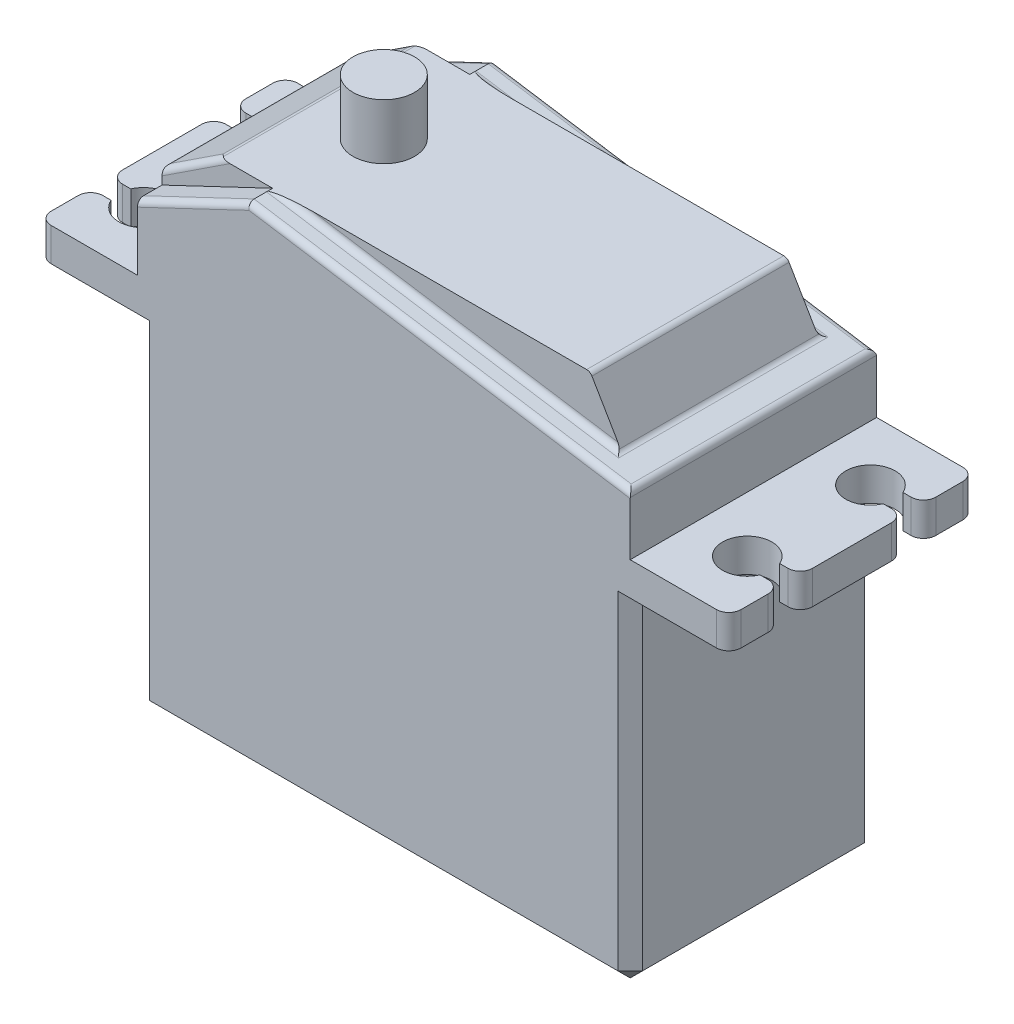
from build123d import *

# Parameters (mm, degrees)
EXTRUDE_1_DEPTH     = 27.7
EXTRUDE_2_DEPTH     = 2.7
SKETCH_3_W          = 40
SKETCH_3_H          = 20.000000000000004
EXTRUDE_3_DEPTH     = 9.600000000000001
SKETCH_4_R          = 2.5000000000000004
EXTRUDE_4_DEPTH     = 4.5
CHAMFER_1_SIZE      = 1
FILLET_1_R          = 1
CUT_EXTRUDE_1_DEPTH = 2
CUT_EXTRUDE_2_DEPTH = 2
CUT_EXTRUDE_3_DEPTH = 44.304618691312825
CUT_EXTRUDE_4_DEPTH = 44.304618691312825
FILLET_3_R          = 0.5


with BuildPart() as part:
    # 草图1 → 凸台-拉伸1 (new body)
    with BuildSketch(Plane(origin=(0, 0, 0), x_dir=(1, 0, 0), z_dir=(0, 1, 0))):
        Polygon((-19.999999999999996, 10), (20.000000000000004, 10), (20.00000000000001, -10), (-19.99999999999999, -10), align=None)
    extrude(amount=-EXTRUDE_1_DEPTH)

    # 草图2 → 凸台-拉伸2 (add)
    with BuildSketch(Plane(origin=(0, 0, 0), x_dir=(1, 0, 0), z_dir=(0, 1, 0))):
        with BuildLine():
            Line((-26.999999999999996, 9.999999999999998), (26.99999999999999, 9.999999999999998))
            ThreePointArc((26.99999999999999, 9.999999999999998), (27.707106781186543, 9.707106781186546), (27.999999999999996, 8.999999999999991))
            Line((27.999999999999996, 8.999999999999991), (27.999999999999996, 6.800000000000006))
            ThreePointArc((27.999999999999996, 6.800000000000006), (27.707106781186543, 6.092893218813451), (26.99999999999999, 5.799999999999999))
            Line((26.99999999999999, 5.799999999999999), (26.33303027798234, 5.799999999999999))
            ThreePointArc((26.33303027798234, 5.799999999999999), (22.499999999999996, 4.999999999999993), (26.333030277982342, 4.2))
            Line((26.333030277982342, 4.2), (26.999999999999993, 4.2))
            ThreePointArc((26.999999999999993, 4.2), (27.707106781186546, 3.907106781186547), (28, 3.1999999999999926))
            Line((28, 3.1999999999999926), (28, -3.199999999999997))
            ThreePointArc((28, -3.199999999999997), (27.70710678118655, -3.9071067811865494), (27, -4.200000000000005))
            Line((27, -4.200000000000005), (26.333030277982342, -4.200000000000008))
            ThreePointArc((26.333030277982342, -4.200000000000008), (22.499999999999996, -5.000000000000002), (26.333030277982342, -5.8000000000000025))
            Line((26.333030277982342, -5.8000000000000025), (26.999999999999996, -5.8000000000000025))
            ThreePointArc((26.999999999999996, -5.8000000000000025), (27.70710678118655, -6.092893218813455), (28.000000000000004, -6.80000000000001))
            Line((28.000000000000004, -6.80000000000001), (28.000000000000004, -8.999999999999995))
            ThreePointArc((28.000000000000004, -8.999999999999995), (27.70710678118655, -9.70710678118655), (26.999999999999996, -10.000000000000002))
            Line((26.999999999999996, -10.000000000000002), (-26.999999999999993, -10.000000000000002))
            ThreePointArc((-26.999999999999993, -10.000000000000002), (-27.70710678118655, -9.70710678118655), (-28, -8.999999999999995))
            Line((-28, -8.999999999999995), (-28, -6.800000000000009))
            ThreePointArc((-28, -6.800000000000009), (-27.707106781186546, -6.092893218813454), (-26.999999999999993, -5.800000000000002))
            Line((-26.999999999999993, -5.800000000000002), (-26.333030277982335, -5.800000000000002))
            ThreePointArc((-26.333030277982335, -5.800000000000002), (-22.5, -5), (-26.333030277982335, -4.199999999999999))
            Line((-26.333030277982335, -4.199999999999999), (-26.999999999999993, -4.199999999999999))
            ThreePointArc((-26.999999999999993, -4.199999999999999), (-27.707106781186546, -3.9071067811865468), (-28, -3.1999999999999926))
            Line((-28, -3.1999999999999926), (-28.000000000000004, 3.1999999999999917))
            ThreePointArc((-28.000000000000004, 3.1999999999999917), (-27.707106781186553, 3.9071067811865468), (-26.999999999999996, 4.2))
            Line((-26.999999999999996, 4.2), (-26.333030277982335, 4.2))
            ThreePointArc((-26.333030277982335, 4.2), (-22.5, 5), (-26.333030277982335, 5.800000000000001))
            Line((-26.333030277982335, 5.800000000000001), (-26.999999999999996, 5.800000000000001))
            ThreePointArc((-26.999999999999996, 5.800000000000001), (-27.70710678118655, 6.092893218813453), (-28.000000000000004, 6.800000000000008))
            Line((-28.000000000000004, 6.800000000000008), (-28.000000000000004, 8.999999999999991))
            ThreePointArc((-28.000000000000004, 8.999999999999991), (-27.70710678118655, 9.707106781186546), (-26.999999999999996, 9.999999999999998))
        make_face()
    extrude(amount=EXTRUDE_2_DEPTH)

    # 草图3 → 凸台-拉伸3 (add)
    with BuildSketch(Plane(origin=(0, 2.7, 0), x_dir=(1, 0, 0), z_dir=(0, 1, 0))):
        Rectangle(SKETCH_3_W, SKETCH_3_H)
    extrude(amount=EXTRUDE_3_DEPTH)

    # 草图4 → 凸台-拉伸4 (add)
    with BuildSketch(Plane(origin=(0, 12.300000000000002, 0), x_dir=(1, 0, 0), z_dir=(0, 1, 0))):
        with Locations(Location((-10.000000000000004, 0, 0), (0, 0, 270))):
            Circle(SKETCH_4_R)
    extrude(amount=EXTRUDE_4_DEPTH)

    # 倒角1
    chamfer_1_edges = [part.edges().sort_by_distance(p)[0] for p in [
        (-19.999999999999993, -27.7, 0),
        (1.066e-14, -27.7, 10),
        (20.000000000000007, -27.7, 0),
        (3.55e-15, -27.7, -10),
        (20.00000000000001, -13.85, 10),
        (-19.99999999999999, -13.85, 10),
        (-19.999999999999996, -13.85, -10),
        (20.000000000000004, -13.85, -10),
    ]]
    chamfer(chamfer_1_edges, length=CHAMFER_1_SIZE)

    # 圆角1
    fillet_1_edges = [part.edges().sort_by_distance(p)[0] for p in [
        (20.000000000000007, 0, 1.78e-15),
        (-19.999999999999993, 0, 1.78e-15),
    ]]
    fillet(fillet_1_edges, radius=FILLET_1_R)

    # 草图5 → 切除-拉伸1 (cut)
    with BuildSketch(Plane.XY.offset(10)):
        Polygon((-20.000000000000004, 12.300000000000002), (-20.000000000000004, 8.035927133186778), (-11.021709653774844, 12.300000000000002), align=None)
        Polygon((19.999999999999996, 12.300000000000002), (-11.021709653774844, 12.300000000000002), (19.999999999999996, 7.500000000000002), align=None)
    extrude(amount=-CUT_EXTRUDE_1_DEPTH, mode=Mode.SUBTRACT)

    # 草图6 → 切除-拉伸2 (cut)
    with BuildSketch(Plane(origin=(0, 0, -10), x_dir=(-1, 0, 0), z_dir=(0, 0, -1))):
        Polygon((-19.999999999999996, 12.300000000000002), (-19.999999999999996, 7.500000000000002), (11.021709653774877, 12.300000000000006), align=None)
        Polygon((20.000000000000004, 12.300000000000002), (11.021709653774877, 12.300000000000002), (20.000000000000004, 8.035927133186778), (20.000000000000004, 8.518007588496584), align=None)
    extrude(amount=-CUT_EXTRUDE_2_DEPTH, mode=Mode.SUBTRACT)

    # 草图7 → 切除-拉伸3 (cut, through all)
    with BuildSketch(Plane.XY.offset(8)):
        Polygon((14.749194246022505, 12.300000000000002), (17.321583388310543, 7.914432340435016), (19.999999999999996, 7.500000000000002), (19.999999999999996, 12.300000000000002), align=None)
    extrude(amount=-CUT_EXTRUDE_3_DEPTH, mode=Mode.SUBTRACT)

    # 草图8 → 切除-拉伸4 (cut, through all)
    with BuildSketch(Plane(origin=(0, 0, -8), x_dir=(-1, 0, 0), z_dir=(0, 0, -1))):
        Polygon((15.395101165410264, 12.3), (20.000000000000004, 9.27677625524631), (20.000000000000004, 12.300000000000002), align=None)
    extrude(amount=-CUT_EXTRUDE_4_DEPTH, mode=Mode.SUBTRACT)

    # 圆角3
    # the kernel refuses this fillet: 0.5 mm, written as the material it adds along each edge
    with BuildSketch(Plane(origin=(18.55688339677409, 7.723293937464904, -8), x_dir=(6e-17, 4.1e-16, -1), z_dir=(-0.9882400067708363, 0.15291072237608927, 0))) as fillet_3_piece_1_section:
        with BuildLine():
            CenterArc((FILLET_3_R, -FILLET_3_R), FILLET_3_R, 90.00000000000003, 90.00000000000011)
            Line((2.1e-16, -FILLET_3_R), (-FILLET_3_R * 0.02, -FILLET_3_R))
            Line((-FILLET_3_R * 0.02, -FILLET_3_R), (-FILLET_3_R * 0.02, FILLET_3_R * 0.02))
            Line((-FILLET_3_R * 0.02, FILLET_3_R * 0.02), (FILLET_3_R, FILLET_3_R * 0.02))
            Line((FILLET_3_R, FILLET_3_R * 0.02), (FILLET_3_R, 0))
        make_face()
    fillet_3_piece_1 = extrude(amount=31.180576426671607, mode=Mode.PRIVATE)
    fillet_3_piece_1 = split(fillet_3_piece_1, bisect_by=Plane(origin=(-0.01892956266556034, 17.525566810248893, -8.114981645981509), z_dir=(0.4290063256586747, -0.9033014848569901, 0)), keep=Keep.TOP, mode=Mode.PRIVATE)
    fillet_3_piece_1 = split(fillet_3_piece_1, bisect_by=Plane(origin=(3.4752380562903062, 12.3, -8.114981645981509), z_dir=(0, -1, 0)), keep=Keep.TOP, mode=Mode.PRIVATE)
    fillet_3_piece_1 = split(fillet_3_piece_1, bisect_by=Plane(origin=(12.79355457582578, 15.634095122073386, -8.114981645981509), z_dir=(-0.8625658684116786, -0.5059447822156158, 0)), keep=Keep.TOP, mode=Mode.PRIVATE)
    add(fillet_3_piece_1)
    with BuildSketch(Plane(origin=(-12.257009662238392, 12.491138402970114, 8), x_dir=(5.4e-16, 3.47e-15, 1), z_dir=(0.9882400067708363, -0.15291072237608935, 0))) as fillet_3_piece_2_section:
        with BuildLine():
            CenterArc((FILLET_3_R, -FILLET_3_R), FILLET_3_R, 90.0000000000002, 89.9999999999998)
            Line((1.76e-15, -FILLET_3_R), (-FILLET_3_R * 0.02, -FILLET_3_R))
            Line((-FILLET_3_R * 0.02, -FILLET_3_R), (-FILLET_3_R * 0.02, FILLET_3_R * 0.02))
            Line((-FILLET_3_R * 0.02, FILLET_3_R * 0.02), (FILLET_3_R, FILLET_3_R * 0.02))
            Line((FILLET_3_R, FILLET_3_R * 0.02), (FILLET_3_R, 0))
        make_face()
    fillet_3_piece_2 = extrude(amount=31.18057642667156, mode=Mode.PRIVATE)
    fillet_3_piece_2 = split(fillet_3_piece_2, bisect_by=Plane(origin=(-0.0189295626653454, 17.525566810248954, 8.114981645981516), z_dir=(0.4290063256586731, -0.9033014848569909, 0)), keep=Keep.TOP, mode=Mode.PRIVATE)
    fillet_3_piece_2 = split(fillet_3_piece_2, bisect_by=Plane(origin=(3.4752380562905487, 12.3, 8.114981645981516), z_dir=(0, -1, 0)), keep=Keep.TOP, mode=Mode.PRIVATE)
    fillet_3_piece_2 = split(fillet_3_piece_2, bisect_by=Plane(origin=(12.793554575825858, 15.634095122073255, 8.114981645981516), z_dir=(-0.8625658684116786, -0.5059447822156158, 0)), keep=Keep.TOP, mode=Mode.PRIVATE)
    add(fillet_3_piece_2)
    with BuildSketch(Plane(origin=(17.321583388310543, 7.914432340435016, 8), x_dir=(0.9882400067708361, -0.15291072237609032, 0), z_dir=(0, 0, -1))) as fillet_3_piece_3:
        with BuildLine():
            CenterArc((FILLET_3_R * 0.47494469979, -FILLET_3_R), FILLET_3_R, 90.00000000000009, 50.81026573498599)
            Line((-FILLET_3_R * 0.300113017719, -FILLET_3_R * 0.368109554962), (-FILLET_3_R * 0.315614172069, -FILLET_3_R * 0.355471746061))
            Line((-FILLET_3_R * 0.315614172069, -FILLET_3_R * 0.355471746061), (-FILLET_3_R * 0.0094988939958, FILLET_3_R * 0.02))
            Line((-FILLET_3_R * 0.0094988939958, FILLET_3_R * 0.02), (FILLET_3_R * 0.47494469979, FILLET_3_R * 0.02))
            Line((FILLET_3_R * 0.47494469979, FILLET_3_R * 0.02), (FILLET_3_R * 0.47494469979, 0))
        make_face()
    extrude(amount=15.999999999999998)
    with BuildSketch(Plane(origin=(17.321583388310543, 7.914432340435016, 8), x_dir=(0.9882400067708361, -0.15291072237609032, 0), z_dir=(0, 0, -1))) as fillet_3_piece_4a_section:
        with BuildLine():
            CenterArc((FILLET_3_R * 0.47494469979, -FILLET_3_R), FILLET_3_R, 90.00000000000009, 50.81026573498599)
            Line((-FILLET_3_R * 0.300113017719, -FILLET_3_R * 0.368109554962), (-FILLET_3_R * 0.315614172069, -FILLET_3_R * 0.355471746061))
            Line((-FILLET_3_R * 0.315614172069, -FILLET_3_R * 0.355471746061), (-FILLET_3_R * 0.0094988939958, FILLET_3_R * 0.02))
            Line((-FILLET_3_R * 0.0094988939958, FILLET_3_R * 0.02), (FILLET_3_R * 0.47494469979, FILLET_3_R * 0.02))
            Line((FILLET_3_R * 0.47494469979, FILLET_3_R * 0.02), (FILLET_3_R * 0.47494469979, 0))
        make_face()
    fillet_3_piece_4a = extrude(amount=16.593680874737203, mode=Mode.PRIVATE)
    fillet_3_piece_4a = split(fillet_3_piece_4a, bisect_by=Plane(origin=(17.346078817666946, 7.95047521751959, -8), z_dir=(0, 0, -1)), keep=Keep.TOP, mode=Mode.PRIVATE)
    with BuildSketch(Plane(origin=(18.55688339677409, 7.723293937464904, -8), x_dir=(6e-17, 4.1e-16, -1), z_dir=(-0.9882400067708363, 0.15291072237608927, 0))) as fillet_3_piece_4b_section:
        with BuildLine():
            CenterArc((FILLET_3_R, -FILLET_3_R), FILLET_3_R, 90.00000000000003, 90.00000000000011)
            Line((2.1e-16, -FILLET_3_R), (-FILLET_3_R * 0.02, -FILLET_3_R))
            Line((-FILLET_3_R * 0.02, -FILLET_3_R), (-FILLET_3_R * 0.02, FILLET_3_R * 0.02))
            Line((-FILLET_3_R * 0.02, FILLET_3_R * 0.02), (FILLET_3_R, FILLET_3_R * 0.02))
            Line((FILLET_3_R, FILLET_3_R * 0.02), (FILLET_3_R, 0))
        make_face()
    fillet_3_piece_4b = extrude(amount=31.180576426671607, mode=Mode.PRIVATE)
    fillet_3_piece_4b = split(fillet_3_piece_4b, bisect_by=Plane(origin=(17.458568610998494, 7.680891484355894, -8.109028377758598), z_dir=(0.8625658684116786, 0.5059447822156158, 0)), keep=Keep.TOP, mode=Mode.PRIVATE)
    fillet_3_piece_4 = fillet_3_piece_4a & fillet_3_piece_4b
    add(fillet_3_piece_4)
    with BuildSketch(Plane(origin=(-12.257009662238392, 12.491138402970114, 8), x_dir=(5.4e-16, 3.47e-15, 1), z_dir=(0.9882400067708363, -0.15291072237608935, 0))) as fillet_3_piece_5a_section:
        with BuildLine():
            CenterArc((FILLET_3_R, -FILLET_3_R), FILLET_3_R, 90.0000000000002, 89.9999999999998)
            Line((1.76e-15, -FILLET_3_R), (-FILLET_3_R * 0.02, -FILLET_3_R))
            Line((-FILLET_3_R * 0.02, -FILLET_3_R), (-FILLET_3_R * 0.02, FILLET_3_R * 0.02))
            Line((-FILLET_3_R * 0.02, FILLET_3_R * 0.02), (FILLET_3_R, FILLET_3_R * 0.02))
            Line((FILLET_3_R, FILLET_3_R * 0.02), (FILLET_3_R, 0))
        make_face()
    fillet_3_piece_5a = extrude(amount=31.18057642667156, mode=Mode.PRIVATE)
    fillet_3_piece_5a = split(fillet_3_piece_5a, bisect_by=Plane(origin=(17.458568610998455, 7.68089148435596, 8.109028377758605), z_dir=(0.8625658684116786, 0.5059447822156158, 0)), keep=Keep.TOP, mode=Mode.PRIVATE)
    with BuildSketch(Plane(origin=(17.321583388310543, 7.914432340435015, 8.593680874737206), x_dir=(0.9882400067708367, -0.15291072237608666, 0), z_dir=(0, 0, -1))) as fillet_3_piece_5b_section:
        with BuildLine():
            CenterArc((FILLET_3_R * 0.47494469979, -FILLET_3_R), FILLET_3_R, 90.0000000000003, 50.810265734986004)
            Line((-FILLET_3_R * 0.300113017719, -FILLET_3_R * 0.368109554962), (-FILLET_3_R * 0.315614172069, -FILLET_3_R * 0.355471746061))
            Line((-FILLET_3_R * 0.315614172069, -FILLET_3_R * 0.355471746061), (-FILLET_3_R * 0.0094988939958, FILLET_3_R * 0.02))
            Line((-FILLET_3_R * 0.0094988939958, FILLET_3_R * 0.02), (FILLET_3_R * 0.47494469979, FILLET_3_R * 0.02))
            Line((FILLET_3_R * 0.47494469979, FILLET_3_R * 0.02), (FILLET_3_R * 0.47494469979, 0))
        make_face()
    fillet_3_piece_5b = extrude(amount=16.593680874737203, mode=Mode.PRIVATE)
    fillet_3_piece_5b = split(fillet_3_piece_5b, bisect_by=Plane(origin=(17.346078817666942, 7.950475217519592, 8), z_dir=(0, 0, 1)), keep=Keep.TOP, mode=Mode.PRIVATE)
    fillet_3_piece_5 = fillet_3_piece_5a & fillet_3_piece_5b
    add(fillet_3_piece_5)
    # the kernel refuses this fillet: 0.5 mm, written as the material it takes off along each edge
    with BuildSketch(Plane(origin=(-21.12912685607124, 7.499669226113436, 10.000000000000002), x_dir=(-6.2e-16, 1.3e-15, -1), z_dir=(0.9033014848569909, 0.4290063256586731, 0))) as fillet_3_2_piece_1_section:
        with BuildLine():
            CenterArc((FILLET_3_R, -FILLET_3_R), FILLET_3_R, 89.99999999999993, 90.00000000000017)
            Line((-7.2e-16, -FILLET_3_R), (-FILLET_3_R * 0.02, -FILLET_3_R))
            Line((-FILLET_3_R * 0.02, -FILLET_3_R), (-FILLET_3_R * 0.02, FILLET_3_R * 0.02))
            Line((-FILLET_3_R * 0.02, FILLET_3_R * 0.02), (FILLET_3_R, FILLET_3_R * 0.02))
            Line((FILLET_3_R, FILLET_3_R * 0.02), (FILLET_3_R, 0))
        make_face()
    fillet_3_2_piece_1 = extrude(amount=12.439417234154758, mode=Mode.PRIVATE)
    fillet_3_2_piece_1 = split(fillet_3_2_piece_1, bisect_by=Plane(origin=(-14.972592275789518, 12.911321451890478, 9.888117464776716), z_dir=(-0.15291072237608935, -0.9882400067708363, 0)), keep=Keep.TOP, mode=Mode.PRIVATE)
    fillet_3_2_piece_1 = split(fillet_3_2_piece_1, bisect_by=Plane(origin=(-20.000000000000004, 10.088373749739164, 9.888117464776716), z_dir=(1, 0, 0)), keep=Keep.TOP, mode=Mode.PRIVATE)
    add(fillet_3_2_piece_1, mode=Mode.SUBTRACT)
    with BuildSketch(Plane(origin=(-12.257009662238392, 12.491138402970114, 10.000000000000002), x_dir=(5.4e-16, 3.47e-15, -1), z_dir=(0.9882400067708363, -0.15291072237608935, 0))) as fillet_3_2_piece_2_section:
        with BuildLine():
            CenterArc((FILLET_3_R, -FILLET_3_R), FILLET_3_R, 89.9999999999998, 90.00000000000023)
            Line((-1.76e-15, -FILLET_3_R), (-FILLET_3_R * 0.02, -FILLET_3_R))
            Line((-FILLET_3_R * 0.02, -FILLET_3_R), (-FILLET_3_R * 0.02, FILLET_3_R * 0.02))
            Line((-FILLET_3_R * 0.02, FILLET_3_R * 0.02), (FILLET_3_R, FILLET_3_R * 0.02))
            Line((FILLET_3_R, FILLET_3_R * 0.02), (FILLET_3_R, 0))
        make_face()
    fillet_3_2_piece_2 = extrude(amount=33.8908660256946, mode=Mode.PRIVATE)
    fillet_3_2_piece_2 = split(fillet_3_2_piece_2, bisect_by=Plane(origin=(19.999999999999996, 9.79899811194415, 9.88715596257419), z_dir=(-1, 0, 0)), keep=Keep.TOP, mode=Mode.PRIVATE)
    fillet_3_2_piece_2 = split(fillet_3_2_piece_2, bisect_by=Plane(origin=(0.5906251511246445, 17.815063542441713, 9.887155962574187), z_dir=(0.4290063256586731, -0.9033014848569909, 0)), keep=Keep.TOP, mode=Mode.PRIVATE)
    add(fillet_3_2_piece_2, mode=Mode.SUBTRACT)
    with BuildSketch(Plane(origin=(19.999999999999996, 7.500000000000002, 10), x_dir=(0, -1, 0), z_dir=(0, 0, -1))) as fillet_3_2_piece_3:
        with BuildLine():
            CenterArc((FILLET_3_R * 0.857169586153, FILLET_3_R), FILLET_3_R, 188.79564505060517, 81.20435494939483)
            Line((-FILLET_3_R * 0.131070420618, FILLET_3_R * 0.847089277624), (-FILLET_3_R * 0.150835220753, FILLET_3_R * 0.844031063176))
            Line((-FILLET_3_R * 0.150835220753, FILLET_3_R * 0.844031063176), (-FILLET_3_R * 0.0171433917231, -FILLET_3_R * 0.02))
            Line((-FILLET_3_R * 0.0171433917231, -FILLET_3_R * 0.02), (FILLET_3_R * 0.857169586153, -FILLET_3_R * 0.02))
            Line((FILLET_3_R * 0.857169586153, -FILLET_3_R * 0.02), (FILLET_3_R * 0.857169586153, 0))
        make_face()
    extrude(amount=20, mode=Mode.SUBTRACT)
    with BuildSketch(Plane(origin=(-12.257009662238424, 12.491138402970119, -9.999999999999996), x_dir=(0, 0, 1), z_dir=(0.9882400067708363, -0.15291072237608921, 0))) as fillet_3_2_piece_4_section:
        with BuildLine():
            CenterArc((FILLET_3_R, FILLET_3_R), FILLET_3_R, 180, 90)
            Line((0, FILLET_3_R), (-FILLET_3_R * 0.02, FILLET_3_R))
            Line((-FILLET_3_R * 0.02, FILLET_3_R), (-FILLET_3_R * 0.02, -FILLET_3_R * 0.02))
            Line((-FILLET_3_R * 0.02, -FILLET_3_R * 0.02), (FILLET_3_R, -FILLET_3_R * 0.02))
            Line((FILLET_3_R, -FILLET_3_R * 0.02), (FILLET_3_R, 0))
        make_face()
    fillet_3_2_piece_4 = extrude(amount=33.890866025694635, mode=Mode.PRIVATE)
    fillet_3_2_piece_4 = split(fillet_3_2_piece_4, bisect_by=Plane(origin=(19.999999999999996, 9.798998111939396, -9.887155962573853), z_dir=(-1, 0, 0)), keep=Keep.TOP, mode=Mode.PRIVATE)
    fillet_3_2_piece_4 = split(fillet_3_2_piece_4, bisect_by=Plane(origin=(0.5906251511489238, 17.815063542453288, -9.887155962573853), z_dir=(0.4290063256586747, -0.9033014848569901, 0)), keep=Keep.TOP, mode=Mode.PRIVATE)
    add(fillet_3_2_piece_4, mode=Mode.SUBTRACT)
    with BuildSketch(Plane(origin=(-9.89258279770364, 12.83625790707335, -9.999999999999998), x_dir=(0, 0, 1), z_dir=(-0.9033014848569901, -0.4290063256586747, 0))) as fillet_3_2_piece_5_section:
        with BuildLine():
            CenterArc((FILLET_3_R, -FILLET_3_R), FILLET_3_R, 90, 90)
            Line((0, -FILLET_3_R), (-FILLET_3_R * 0.02, -FILLET_3_R))
            Line((-FILLET_3_R * 0.02, -FILLET_3_R), (-FILLET_3_R * 0.02, FILLET_3_R * 0.02))
            Line((-FILLET_3_R * 0.02, FILLET_3_R * 0.02), (FILLET_3_R, FILLET_3_R * 0.02))
            Line((FILLET_3_R, FILLET_3_R * 0.02), (FILLET_3_R, 0))
        make_face()
    fillet_3_2_piece_5 = extrude(amount=12.439417234154732, mode=Mode.PRIVATE)
    fillet_3_2_piece_5 = split(fillet_3_2_piece_5, bisect_by=Plane(origin=(-14.972592275789577, 12.911321451890487, -9.888117464776716), z_dir=(-0.15291072237608935, -0.9882400067708363, 0)), keep=Keep.TOP, mode=Mode.PRIVATE)
    fillet_3_2_piece_5 = split(fillet_3_2_piece_5, bisect_by=Plane(origin=(-20.000000000000004, 10.08837374973913, -9.888117464776718), z_dir=(1, 0, 0)), keep=Keep.TOP, mode=Mode.PRIVATE)
    add(fillet_3_2_piece_5, mode=Mode.SUBTRACT)
    with BuildSketch(Plane(origin=(14.749194246022505, 12.300000000000002, 8), x_dir=(-1, -6.2e-15, 0), z_dir=(0, 0, -1))) as fillet_3_2_piece_6:
        with BuildLine():
            CenterArc((FILLET_3_R * 0.572773901539, -FILLET_3_R), FILLET_3_R, 90.00000000000036, 59.60591078559024)
            Line((-FILLET_3_R * 0.289791966873, -FILLET_3_R * 0.494055217784), (-FILLET_3_R * 0.307043284241, -FILLET_3_R * 0.48393632214))
            Line((-FILLET_3_R * 0.307043284241, -FILLET_3_R * 0.48393632214), (-FILLET_3_R * 0.0114554780308, FILLET_3_R * 0.02))
            Line((-FILLET_3_R * 0.0114554780308, FILLET_3_R * 0.02), (FILLET_3_R * 0.572773901539, FILLET_3_R * 0.02))
            Line((FILLET_3_R * 0.572773901539, FILLET_3_R * 0.02), (FILLET_3_R * 0.572773901539, 0))
        make_face()
    extrude(amount=16, mode=Mode.SUBTRACT)
    with BuildSketch(Plane(origin=(-21.044928835418773, 8.590756044967945, 8), x_dir=(0.5488161682226917, -0.8359430683350166, 0), z_dir=(0.8359430683350165, 0.5488161682226917, 0))) as fillet_3_2_piece_7_section:
        with BuildLine():
            CenterArc((FILLET_3_R, FILLET_3_R), FILLET_3_R, 180, 90)
            Line((0, FILLET_3_R), (-FILLET_3_R * 0.02, FILLET_3_R))
            Line((-FILLET_3_R * 0.02, FILLET_3_R), (-FILLET_3_R * 0.02, -FILLET_3_R * 0.02))
            Line((-FILLET_3_R * 0.02, -FILLET_3_R * 0.02), (FILLET_3_R, -FILLET_3_R * 0.02))
            Line((FILLET_3_R, -FILLET_3_R * 0.02), (FILLET_3_R, 0))
        make_face()
    fillet_3_2_piece_7 = extrude(amount=8.008627332434868, mode=Mode.PRIVATE)
    fillet_3_2_piece_7 = split(fillet_3_2_piece_7, bisect_by=Plane(origin=(-20.000000000000004, 10.718049593764281, 7.889402076403062), z_dir=(1, 0, 0)), keep=Keep.TOP, mode=Mode.PRIVATE)
    fillet_3_2_piece_7 = split(fillet_3_2_piece_7, bisect_by=Plane(origin=(-17.590412686485557, 12.3, 7.889402076403062), z_dir=(0, -1, 0)), keep=Keep.TOP, mode=Mode.PRIVATE)
    add(fillet_3_2_piece_7, mode=Mode.SUBTRACT)
    with BuildSketch(Plane(origin=(-15.395101165410264, 12.3, -8), x_dir=(-0.8359430683350166, -0.5488161682226915, 0), z_dir=(0, 0, 1))) as fillet_3_2_piece_8:
        with BuildLine():
            CenterArc((FILLET_3_R * 0.298928750945, FILLET_3_R), FILLET_3_R, 236.71416498503527, 33.28583501496479)
            Line((-FILLET_3_R * 0.249887417278, FILLET_3_R * 0.164056931665), (-FILLET_3_R * 0.260863740643, FILLET_3_R * 0.147338070298))
            Line((-FILLET_3_R * 0.260863740643, FILLET_3_R * 0.147338070298), (-FILLET_3_R * 0.00597857501889, -FILLET_3_R * 0.02))
            Line((-FILLET_3_R * 0.00597857501889, -FILLET_3_R * 0.02), (FILLET_3_R * 0.298928750945, -FILLET_3_R * 0.02))
            Line((FILLET_3_R * 0.298928750945, -FILLET_3_R * 0.02), (FILLET_3_R * 0.298928750945, 1e-17))
        make_face()
    extrude(amount=16, mode=Mode.SUBTRACT)
    with BuildSketch(Plane(origin=(-20.000000000000004, 9.27677625524631, -8), x_dir=(0, -1, 0), z_dir=(0, 0, 1))) as fillet_3_2_piece_9:
        with BuildLine():
            CenterArc((FILLET_3_R * 0.539730334359, FILLET_3_R), FILLET_3_R, 213.2858350149648, 56.71416498503521)
            Line((-FILLET_3_R * 0.296212733976, FILLET_3_R * 0.451183831777), (-FILLET_3_R * 0.312931595343, FILLET_3_R * 0.440207508413))
            Line((-FILLET_3_R * 0.312931595343, FILLET_3_R * 0.440207508413), (-FILLET_3_R * 0.0107946066872, -FILLET_3_R * 0.02))
            Line((-FILLET_3_R * 0.0107946066872, -FILLET_3_R * 0.02), (FILLET_3_R * 0.539730334359, -FILLET_3_R * 0.02))
            Line((FILLET_3_R * 0.539730334359, -FILLET_3_R * 0.02), (FILLET_3_R * 0.539730334359, 0))
        make_face()
    extrude(amount=16, mode=Mode.SUBTRACT)
    with BuildSketch(Plane(origin=(-14.350172329991493, 12.986020210278365, -8), x_dir=(0, 0, 1), z_dir=(-0.8359430683350165, -0.5488161682226917, 0))) as fillet_3_2_piece_10_section:
        with BuildLine():
            CenterArc((FILLET_3_R, -FILLET_3_R), FILLET_3_R, 90, 90)
            Line((0, -FILLET_3_R), (-FILLET_3_R * 0.02, -FILLET_3_R))
            Line((-FILLET_3_R * 0.02, -FILLET_3_R), (-FILLET_3_R * 0.02, FILLET_3_R * 0.02))
            Line((-FILLET_3_R * 0.02, FILLET_3_R * 0.02), (FILLET_3_R, FILLET_3_R * 0.02))
            Line((FILLET_3_R, FILLET_3_R * 0.02), (FILLET_3_R, 0))
        make_face()
    fillet_3_2_piece_10 = extrude(amount=8.008627332434868, mode=Mode.PRIVATE)
    fillet_3_2_piece_10 = split(fillet_3_2_piece_10, bisect_by=Plane(origin=(-20.000000000000004, 10.718049593765155, -7.88940207640316), z_dir=(1, 0, 0)), keep=Keep.TOP, mode=Mode.PRIVATE)
    fillet_3_2_piece_10 = split(fillet_3_2_piece_10, bisect_by=Plane(origin=(-17.590412686484115, 12.3, -7.889402076403161), z_dir=(0, -1, 0)), keep=Keep.TOP, mode=Mode.PRIVATE)
    add(fillet_3_2_piece_10, mode=Mode.SUBTRACT)
    with BuildSketch(Plane(origin=(-12.257009662238392, 12.491138402970114, 10.000000000000002), x_dir=(5.4e-16, 3.47e-15, -1), z_dir=(0.9882400067708363, -0.15291072237608935, 0))) as fillet_3_2_piece_11a_section:
        with BuildLine():
            CenterArc((FILLET_3_R, -FILLET_3_R), FILLET_3_R, 89.9999999999998, 90.00000000000023)
            Line((-1.76e-15, -FILLET_3_R), (-FILLET_3_R * 0.02, -FILLET_3_R))
            Line((-FILLET_3_R * 0.02, -FILLET_3_R), (-FILLET_3_R * 0.02, FILLET_3_R * 0.02))
            Line((-FILLET_3_R * 0.02, FILLET_3_R * 0.02), (FILLET_3_R, FILLET_3_R * 0.02))
            Line((FILLET_3_R, FILLET_3_R * 0.02), (FILLET_3_R, 0))
        make_face()
    fillet_3_2_piece_11a = extrude(amount=33.8908660256946, mode=Mode.PRIVATE)
    fillet_3_2_piece_11a = split(fillet_3_2_piece_11a, bisect_by=Plane(origin=(-11.591656498032403, 12.029314292542761, 9.877479999177497), z_dir=(-0.4290063256586731, 0.9033014848569909, 0)), keep=Keep.TOP, mode=Mode.PRIVATE)
    with BuildSketch(Plane(origin=(-21.12912685607124, 7.499669226113436, 10.000000000000002), x_dir=(-6.2e-16, 1.3e-15, -1), z_dir=(0.9033014848569909, 0.4290063256586731, 0))) as fillet_3_2_piece_11b_section:
        with BuildLine():
            CenterArc((FILLET_3_R, -FILLET_3_R), FILLET_3_R, 89.99999999999993, 90.00000000000017)
            Line((-7.2e-16, -FILLET_3_R), (-FILLET_3_R * 0.02, -FILLET_3_R))
            Line((-FILLET_3_R * 0.02, -FILLET_3_R), (-FILLET_3_R * 0.02, FILLET_3_R * 0.02))
            Line((-FILLET_3_R * 0.02, FILLET_3_R * 0.02), (FILLET_3_R, FILLET_3_R * 0.02))
            Line((FILLET_3_R, FILLET_3_R * 0.02), (FILLET_3_R, 0))
        make_face()
    fillet_3_2_piece_11b = extrude(amount=12.439417234154758, mode=Mode.PRIVATE)
    fillet_3_2_piece_11b = split(fillet_3_2_piece_11b, bisect_by=Plane(origin=(-10.398170024237615, 12.203519494728608, 9.877479999177513), z_dir=(0.15291072237608935, 0.9882400067708363, 0)), keep=Keep.TOP, mode=Mode.PRIVATE)
    fillet_3_2_piece_11 = fillet_3_2_piece_11a & fillet_3_2_piece_11b
    add(fillet_3_2_piece_11, mode=Mode.SUBTRACT)
    with BuildSketch(Plane(origin=(19.999999999999996, 7.500000000000002, 11.07146198269165), x_dir=(0, -1, 0), z_dir=(0, 0, -1))) as fillet_3_2_piece_12a_section:
        with BuildLine():
            CenterArc((FILLET_3_R * 0.857169586153, FILLET_3_R), FILLET_3_R, 188.79564505060517, 81.20435494939483)
            Line((-FILLET_3_R * 0.131070420618, FILLET_3_R * 0.847089277624), (-FILLET_3_R * 0.150835220753, FILLET_3_R * 0.844031063176))
            Line((-FILLET_3_R * 0.150835220753, FILLET_3_R * 0.844031063176), (-FILLET_3_R * 0.0171433917231, -FILLET_3_R * 0.02))
            Line((-FILLET_3_R * 0.0171433917231, -FILLET_3_R * 0.02), (FILLET_3_R * 0.857169586153, -FILLET_3_R * 0.02))
            Line((FILLET_3_R * 0.857169586153, -FILLET_3_R * 0.02), (FILLET_3_R * 0.857169586153, 0))
        make_face()
    fillet_3_2_piece_12a = extrude(amount=21.07146198269165, mode=Mode.PRIVATE)
    fillet_3_2_piece_12a = split(fillet_3_2_piece_12a, bisect_by=Plane(origin=(19.90562464653715, 7.419104317329177, 10.000000000000002), z_dir=(0, 0, 1)), keep=Keep.TOP, mode=Mode.PRIVATE)
    with BuildSketch(Plane(origin=(-12.257009662238392, 12.491138402970114, 10.000000000000002), x_dir=(5.4e-16, 3.47e-15, -1), z_dir=(0.9882400067708363, -0.15291072237608935, 0))) as fillet_3_2_piece_12b_section:
        with BuildLine():
            CenterArc((FILLET_3_R, -FILLET_3_R), FILLET_3_R, 89.9999999999998, 90.00000000000023)
            Line((-1.76e-15, -FILLET_3_R), (-FILLET_3_R * 0.02, -FILLET_3_R))
            Line((-FILLET_3_R * 0.02, -FILLET_3_R), (-FILLET_3_R * 0.02, FILLET_3_R * 0.02))
            Line((-FILLET_3_R * 0.02, FILLET_3_R * 0.02), (FILLET_3_R, FILLET_3_R * 0.02))
            Line((FILLET_3_R, FILLET_3_R * 0.02), (FILLET_3_R, 0))
        make_face()
    fillet_3_2_piece_12b = extrude(amount=33.8908660256946, mode=Mode.PRIVATE)
    fillet_3_2_piece_12b = split(fillet_3_2_piece_12b, bisect_by=Plane(origin=(19.999999999999996, 7.292684130818659, 9.885940691425203), z_dir=(1, 0, 0)), keep=Keep.TOP, mode=Mode.PRIVATE)
    fillet_3_2_piece_12 = fillet_3_2_piece_12a & fillet_3_2_piece_12b
    add(fillet_3_2_piece_12, mode=Mode.SUBTRACT)
    with BuildSketch(Plane(origin=(19.999999999999996, 7.500000000000002, 10), x_dir=(0, -1, 0), z_dir=(0, 0, -1))) as fillet_3_2_piece_13a_section:
        with BuildLine():
            CenterArc((FILLET_3_R * 0.857169586153, FILLET_3_R), FILLET_3_R, 188.79564505060517, 81.20435494939483)
            Line((-FILLET_3_R * 0.131070420618, FILLET_3_R * 0.847089277624), (-FILLET_3_R * 0.150835220753, FILLET_3_R * 0.844031063176))
            Line((-FILLET_3_R * 0.150835220753, FILLET_3_R * 0.844031063176), (-FILLET_3_R * 0.0171433917231, -FILLET_3_R * 0.02))
            Line((-FILLET_3_R * 0.0171433917231, -FILLET_3_R * 0.02), (FILLET_3_R * 0.857169586153, -FILLET_3_R * 0.02))
            Line((FILLET_3_R * 0.857169586153, -FILLET_3_R * 0.02), (FILLET_3_R * 0.857169586153, 0))
        make_face()
    fillet_3_2_piece_13a = extrude(amount=21.07146198269165, mode=Mode.PRIVATE)
    fillet_3_2_piece_13a = split(fillet_3_2_piece_13a, bisect_by=Plane(origin=(19.905624646537145, 7.419104317329177, -9.999999999999998), z_dir=(0, 0, -1)), keep=Keep.TOP, mode=Mode.PRIVATE)
    with BuildSketch(Plane(origin=(-12.257009662238424, 12.491138402970119, -9.999999999999996), x_dir=(0, 0, 1), z_dir=(0.9882400067708363, -0.15291072237608921, 0))) as fillet_3_2_piece_13b_section:
        with BuildLine():
            CenterArc((FILLET_3_R, FILLET_3_R), FILLET_3_R, 180, 90)
            Line((0, FILLET_3_R), (-FILLET_3_R * 0.02, FILLET_3_R))
            Line((-FILLET_3_R * 0.02, FILLET_3_R), (-FILLET_3_R * 0.02, -FILLET_3_R * 0.02))
            Line((-FILLET_3_R * 0.02, -FILLET_3_R * 0.02), (FILLET_3_R, -FILLET_3_R * 0.02))
            Line((FILLET_3_R, -FILLET_3_R * 0.02), (FILLET_3_R, 0))
        make_face()
    fillet_3_2_piece_13b = extrude(amount=33.890866025694635, mode=Mode.PRIVATE)
    fillet_3_2_piece_13b = split(fillet_3_2_piece_13b, bisect_by=Plane(origin=(19.999999999999996, 7.292684130819048, -9.885940691424882), z_dir=(1, 0, 0)), keep=Keep.TOP, mode=Mode.PRIVATE)
    fillet_3_2_piece_13 = fillet_3_2_piece_13a & fillet_3_2_piece_13b
    add(fillet_3_2_piece_13, mode=Mode.SUBTRACT)
    with BuildSketch(Plane(origin=(-12.257009662238424, 12.491138402970119, -9.999999999999996), x_dir=(0, 0, 1), z_dir=(0.9882400067708363, -0.15291072237608921, 0))) as fillet_3_2_piece_14a_section:
        with BuildLine():
            CenterArc((FILLET_3_R, FILLET_3_R), FILLET_3_R, 180, 90)
            Line((0, FILLET_3_R), (-FILLET_3_R * 0.02, FILLET_3_R))
            Line((-FILLET_3_R * 0.02, FILLET_3_R), (-FILLET_3_R * 0.02, -FILLET_3_R * 0.02))
            Line((-FILLET_3_R * 0.02, -FILLET_3_R * 0.02), (FILLET_3_R, -FILLET_3_R * 0.02))
            Line((FILLET_3_R, -FILLET_3_R * 0.02), (FILLET_3_R, 0))
        make_face()
    fillet_3_2_piece_14a = extrude(amount=33.890866025694635, mode=Mode.PRIVATE)
    fillet_3_2_piece_14a = split(fillet_3_2_piece_14a, bisect_by=Plane(origin=(-11.591656498032439, 12.029314292542761, -9.87747999917749), z_dir=(-0.4290063256586747, 0.9033014848569901, 0)), keep=Keep.TOP, mode=Mode.PRIVATE)
    with BuildSketch(Plane(origin=(-9.89258279770364, 12.83625790707335, -9.999999999999998), x_dir=(0, 0, 1), z_dir=(-0.9033014848569901, -0.4290063256586747, 0))) as fillet_3_2_piece_14b_section:
        with BuildLine():
            CenterArc((FILLET_3_R, -FILLET_3_R), FILLET_3_R, 90, 90)
            Line((0, -FILLET_3_R), (-FILLET_3_R * 0.02, -FILLET_3_R))
            Line((-FILLET_3_R * 0.02, -FILLET_3_R), (-FILLET_3_R * 0.02, FILLET_3_R * 0.02))
            Line((-FILLET_3_R * 0.02, FILLET_3_R * 0.02), (FILLET_3_R, FILLET_3_R * 0.02))
            Line((FILLET_3_R, FILLET_3_R * 0.02), (FILLET_3_R, 0))
        make_face()
    fillet_3_2_piece_14b = extrude(amount=12.439417234154732, mode=Mode.PRIVATE)
    fillet_3_2_piece_14b = split(fillet_3_2_piece_14b, bisect_by=Plane(origin=(-10.398170024237677, 12.203519494728617, -9.877479999177503), z_dir=(0.15291072237608935, 0.9882400067708363, 0)), keep=Keep.TOP, mode=Mode.PRIVATE)
    fillet_3_2_piece_14 = fillet_3_2_piece_14a & fillet_3_2_piece_14b
    add(fillet_3_2_piece_14, mode=Mode.SUBTRACT)
    with BuildSketch(Plane(origin=(-20.000000000000004, 9.27677625524631, -8), x_dir=(0, -1, 0), z_dir=(0, 0, 1))) as fillet_3_2_piece_15a_section:
        with BuildLine():
            CenterArc((FILLET_3_R * 0.539730334359, FILLET_3_R), FILLET_3_R, 213.2858350149648, 56.71416498503521)
            Line((-FILLET_3_R * 0.296212733976, FILLET_3_R * 0.451183831777), (-FILLET_3_R * 0.312931595343, FILLET_3_R * 0.440207508413))
            Line((-FILLET_3_R * 0.312931595343, FILLET_3_R * 0.440207508413), (-FILLET_3_R * 0.0107946066872, -FILLET_3_R * 0.02))
            Line((-FILLET_3_R * 0.0107946066872, -FILLET_3_R * 0.02), (FILLET_3_R * 0.539730334359, -FILLET_3_R * 0.02))
            Line((FILLET_3_R * 0.539730334359, -FILLET_3_R * 0.02), (FILLET_3_R * 0.539730334359, 0))
        make_face()
    fillet_3_2_piece_15a = extrude(amount=16.674662917948396, mode=Mode.PRIVATE)
    fillet_3_2_piece_15a = split(fillet_3_2_piece_15a, bisect_by=Plane(origin=(-19.951321501407552, 9.250502992924924, 8), z_dir=(0, 0, 1)), keep=Keep.TOP, mode=Mode.PRIVATE)
    with BuildSketch(Plane(origin=(-21.044928835418773, 8.590756044967945, 8), x_dir=(0.5488161682226917, -0.8359430683350166, 0), z_dir=(0.8359430683350165, 0.5488161682226917, 0))) as fillet_3_2_piece_15b_section:
        with BuildLine():
            CenterArc((FILLET_3_R, FILLET_3_R), FILLET_3_R, 180, 90)
            Line((0, FILLET_3_R), (-FILLET_3_R * 0.02, FILLET_3_R))
            Line((-FILLET_3_R * 0.02, FILLET_3_R), (-FILLET_3_R * 0.02, -FILLET_3_R * 0.02))
            Line((-FILLET_3_R * 0.02, -FILLET_3_R * 0.02), (FILLET_3_R, -FILLET_3_R * 0.02))
            Line((FILLET_3_R, -FILLET_3_R * 0.02), (FILLET_3_R, 0))
        make_face()
    fillet_3_2_piece_15b = extrude(amount=8.008627332434868, mode=Mode.PRIVATE)
    fillet_3_2_piece_15b = split(fillet_3_2_piece_15b, bisect_by=Plane(origin=(-20.000000000000004, 8.825339101412018, 7.882969358179947), z_dir=(-1, 0, 0)), keep=Keep.TOP, mode=Mode.PRIVATE)
    fillet_3_2_piece_15 = fillet_3_2_piece_15a & fillet_3_2_piece_15b
    add(fillet_3_2_piece_15, mode=Mode.SUBTRACT)
    with BuildSketch(Plane(origin=(-21.044928835418773, 8.590756044967945, 8), x_dir=(0.5488161682226917, -0.8359430683350166, 0), z_dir=(0.8359430683350165, 0.5488161682226917, 0))) as fillet_3_2_piece_16a_section:
        with BuildLine():
            CenterArc((FILLET_3_R, FILLET_3_R), FILLET_3_R, 180, 90)
            Line((0, FILLET_3_R), (-FILLET_3_R * 0.02, FILLET_3_R))
            Line((-FILLET_3_R * 0.02, FILLET_3_R), (-FILLET_3_R * 0.02, -FILLET_3_R * 0.02))
            Line((-FILLET_3_R * 0.02, -FILLET_3_R * 0.02), (FILLET_3_R, -FILLET_3_R * 0.02))
            Line((FILLET_3_R, -FILLET_3_R * 0.02), (FILLET_3_R, 0))
        make_face()
    fillet_3_2_piece_16a = extrude(amount=8.008627332434868, mode=Mode.PRIVATE)
    fillet_3_2_piece_16a = split(fillet_3_2_piece_16a, bisect_by=Plane(origin=(-14.757915387409497, 12.3, 7.877099830729071), z_dir=(0, 1, 0)), keep=Keep.TOP, mode=Mode.PRIVATE)
    with BuildSketch(Plane(origin=(-15.395101165410264, 12.3, -8), x_dir=(-0.8359430683350166, -0.5488161682226915, 0), z_dir=(0, 0, 1))) as fillet_3_2_piece_16b_section:
        with BuildLine():
            CenterArc((FILLET_3_R * 0.298928750945, FILLET_3_R), FILLET_3_R, 236.71416498503527, 33.28583501496479)
            Line((-FILLET_3_R * 0.249887417278, FILLET_3_R * 0.164056931665), (-FILLET_3_R * 0.260863740643, FILLET_3_R * 0.147338070298))
            Line((-FILLET_3_R * 0.260863740643, FILLET_3_R * 0.147338070298), (-FILLET_3_R * 0.00597857501889, -FILLET_3_R * 0.02))
            Line((-FILLET_3_R * 0.00597857501889, -FILLET_3_R * 0.02), (FILLET_3_R * 0.298928750945, -FILLET_3_R * 0.02))
            Line((FILLET_3_R * 0.298928750945, -FILLET_3_R * 0.02), (FILLET_3_R * 0.298928750945, 1e-17))
        make_face()
    fillet_3_2_piece_16b = extrude(amount=16.37366093868069, mode=Mode.PRIVATE)
    fillet_3_2_piece_16b = split(fillet_3_2_piece_16b, bisect_by=Plane(origin=(-15.390292153779736, 12.283912515556525, 8), z_dir=(0, 0, 1)), keep=Keep.TOP, mode=Mode.PRIVATE)
    fillet_3_2_piece_16 = fillet_3_2_piece_16a & fillet_3_2_piece_16b
    add(fillet_3_2_piece_16, mode=Mode.SUBTRACT)
    with BuildSketch(Plane(origin=(-14.350172329991493, 12.986020210278365, -8), x_dir=(0, 0, 1), z_dir=(-0.8359430683350165, -0.5488161682226917, 0))) as fillet_3_2_piece_17a_section:
        with BuildLine():
            CenterArc((FILLET_3_R, -FILLET_3_R), FILLET_3_R, 90, 90)
            Line((0, -FILLET_3_R), (-FILLET_3_R * 0.02, -FILLET_3_R))
            Line((-FILLET_3_R * 0.02, -FILLET_3_R), (-FILLET_3_R * 0.02, FILLET_3_R * 0.02))
            Line((-FILLET_3_R * 0.02, FILLET_3_R * 0.02), (FILLET_3_R, FILLET_3_R * 0.02))
            Line((FILLET_3_R, FILLET_3_R * 0.02), (FILLET_3_R, 0))
        make_face()
    fillet_3_2_piece_17a = extrude(amount=8.008627332434868, mode=Mode.PRIVATE)
    fillet_3_2_piece_17a = split(fillet_3_2_piece_17a, bisect_by=Plane(origin=(-14.757915387409508, 12.3, -7.877099830729066), z_dir=(0, 1, 0)), keep=Keep.TOP, mode=Mode.PRIVATE)
    with BuildSketch(Plane(origin=(-15.395101165410264, 12.3, -8.37366093868069), x_dir=(-0.8359430683350166, -0.5488161682226915, 0), z_dir=(0, 0, 1))) as fillet_3_2_piece_17b_section:
        with BuildLine():
            CenterArc((FILLET_3_R * 0.298928750945, FILLET_3_R), FILLET_3_R, 236.71416498503527, 33.28583501496479)
            Line((-FILLET_3_R * 0.249887417278, FILLET_3_R * 0.164056931665), (-FILLET_3_R * 0.260863740643, FILLET_3_R * 0.147338070298))
            Line((-FILLET_3_R * 0.260863740643, FILLET_3_R * 0.147338070298), (-FILLET_3_R * 0.00597857501889, -FILLET_3_R * 0.02))
            Line((-FILLET_3_R * 0.00597857501889, -FILLET_3_R * 0.02), (FILLET_3_R * 0.298928750945, -FILLET_3_R * 0.02))
            Line((FILLET_3_R * 0.298928750945, -FILLET_3_R * 0.02), (FILLET_3_R * 0.298928750945, 1e-17))
        make_face()
    fillet_3_2_piece_17b = extrude(amount=16.37366093868069, mode=Mode.PRIVATE)
    fillet_3_2_piece_17b = split(fillet_3_2_piece_17b, bisect_by=Plane(origin=(-15.390292153779738, 12.283912515556526, -8), z_dir=(0, 0, -1)), keep=Keep.TOP, mode=Mode.PRIVATE)
    fillet_3_2_piece_17 = fillet_3_2_piece_17a & fillet_3_2_piece_17b
    add(fillet_3_2_piece_17, mode=Mode.SUBTRACT)
    with BuildSketch(Plane(origin=(-20.000000000000004, 9.27677625524631, -8.674662917948394), x_dir=(0, -1, 0), z_dir=(0, 0, 1))) as fillet_3_2_piece_18a_section:
        with BuildLine():
            CenterArc((FILLET_3_R * 0.539730334359, FILLET_3_R), FILLET_3_R, 213.2858350149648, 56.71416498503521)
            Line((-FILLET_3_R * 0.296212733976, FILLET_3_R * 0.451183831777), (-FILLET_3_R * 0.312931595343, FILLET_3_R * 0.440207508413))
            Line((-FILLET_3_R * 0.312931595343, FILLET_3_R * 0.440207508413), (-FILLET_3_R * 0.0107946066872, -FILLET_3_R * 0.02))
            Line((-FILLET_3_R * 0.0107946066872, -FILLET_3_R * 0.02), (FILLET_3_R * 0.539730334359, -FILLET_3_R * 0.02))
            Line((FILLET_3_R * 0.539730334359, -FILLET_3_R * 0.02), (FILLET_3_R * 0.539730334359, 0))
        make_face()
    fillet_3_2_piece_18a = extrude(amount=16.674662917948396, mode=Mode.PRIVATE)
    fillet_3_2_piece_18a = split(fillet_3_2_piece_18a, bisect_by=Plane(origin=(-19.951321501407556, 9.250502992924922, -8), z_dir=(0, 0, -1)), keep=Keep.TOP, mode=Mode.PRIVATE)
    with BuildSketch(Plane(origin=(-14.350172329991493, 12.986020210278365, -8), x_dir=(0, 0, 1), z_dir=(-0.8359430683350165, -0.5488161682226917, 0))) as fillet_3_2_piece_18b_section:
        with BuildLine():
            CenterArc((FILLET_3_R, -FILLET_3_R), FILLET_3_R, 90, 90)
            Line((0, -FILLET_3_R), (-FILLET_3_R * 0.02, -FILLET_3_R))
            Line((-FILLET_3_R * 0.02, -FILLET_3_R), (-FILLET_3_R * 0.02, FILLET_3_R * 0.02))
            Line((-FILLET_3_R * 0.02, FILLET_3_R * 0.02), (FILLET_3_R, FILLET_3_R * 0.02))
            Line((FILLET_3_R, FILLET_3_R * 0.02), (FILLET_3_R, 0))
        make_face()
    fillet_3_2_piece_18b = extrude(amount=8.008627332434868, mode=Mode.PRIVATE)
    fillet_3_2_piece_18b = split(fillet_3_2_piece_18b, bisect_by=Plane(origin=(-20.000000000000004, 8.82533910141178, -7.882969358180036), z_dir=(-1, 0, 0)), keep=Keep.TOP, mode=Mode.PRIVATE)
    fillet_3_2_piece_18 = fillet_3_2_piece_18a & fillet_3_2_piece_18b
    add(fillet_3_2_piece_18, mode=Mode.SUBTRACT)


solid = part.part
